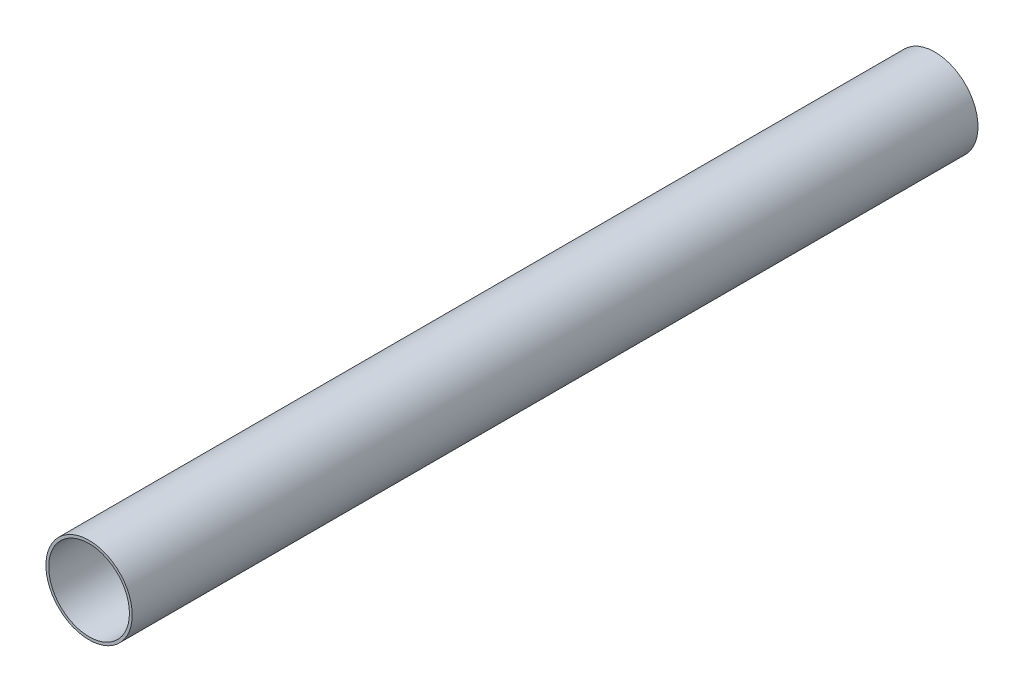
from build123d import *

# Parameters (mm, degrees)
CROQUIS1_R              = 28.0509
CROQUIS1_R_2            = 26.2509
SALIENTE_EXTRUIR1_DEPTH = 550


with BuildPart() as part:
    # Croquis1 → Saliente-Extruir1 (new body)
    with BuildSketch(Plane.XY):
        Circle(CROQUIS1_R)
        Circle(CROQUIS1_R_2, mode=Mode.SUBTRACT)
    extrude(amount=-SALIENTE_EXTRUIR1_DEPTH)


solid = part.part
